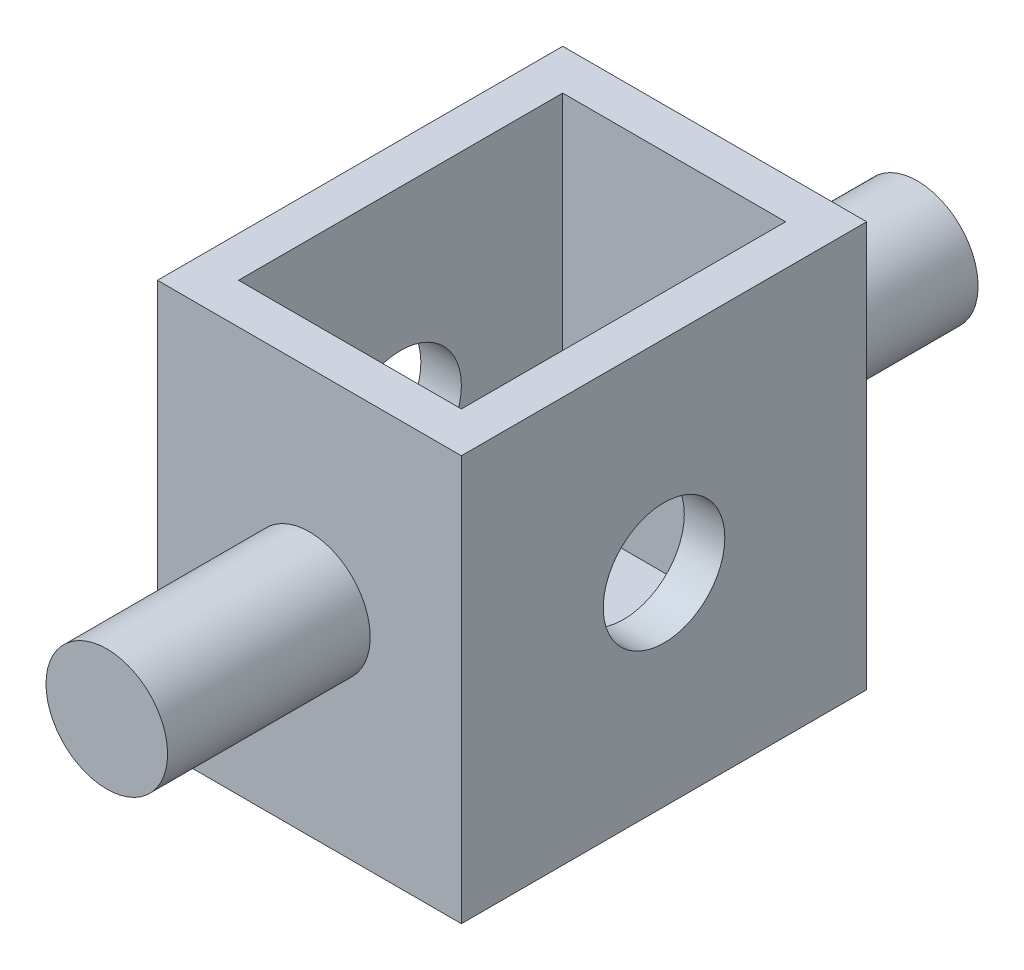
from build123d import *

# Parameters (mm, degrees)
SKETCH1_W          = 19.05
SKETCH1_H          = 25.4
MAIN_BODY_DEPTH    = 25.4
HOLLOW_IT_T        = -2.54
SKETCH3_R          = 3.81
NIBBLE_NO_1_DEPTH  = 12.7
NIBBLE_START       = 12.7
SKETCH4_R          = 3.81
NIBBLE_NO_2_DEPTH  = 12.7
SKETCH5_W          = 1.27
SKETCH5_H          = 3.81
FLAG_DEPTH         = 0.254
SKETCH2_R          = 3.81
NIBBLE_HOLES_DEPTH = 45.45


with BuildPart() as part:
    # Sketch1 → main body (new body)
    with BuildSketch(Plane.XY):
        Rectangle(SKETCH1_W, SKETCH1_H)
    extrude(amount=MAIN_BODY_DEPTH)

    # hollow it
    hollow_it_openings = [part.faces().sort_by_distance(p)[0] for p in [
        (0, 12.7, 12.7),
    ]]
    offset(amount=HOLLOW_IT_T, openings=hollow_it_openings, kind=Kind.INTERSECTION)

    # Sketch3 → nibble no 1 (add)
    with BuildSketch(Plane.XY.offset(25.4)):
        Circle(SKETCH3_R)
    extrude(amount=NIBBLE_NO_1_DEPTH)

    # Sketch4 → nibble no 2 (add)
    with BuildSketch(Plane(origin=(0, 0, 0), x_dir=(-1, 0, 0), z_dir=(0, 0, -1)).offset(NIBBLE_START)):
        Circle(SKETCH4_R)
    extrude(amount=-NIBBLE_NO_2_DEPTH)

    # Sketch5 → flag (add)
    with BuildSketch(Plane(origin=(0, 0, 0), x_dir=(-1, 0, 0), z_dir=(0, -1, 0))):
        with Locations((-0.18666561, 6.353298227)):
            Rectangle(SKETCH5_W, SKETCH5_H)
    extrude(amount=FLAG_DEPTH)

    # Sketch2 → nibble holes (cut, through all)
    with BuildSketch(Plane(origin=(9.525, 0, 0), x_dir=(0, 0, -1), z_dir=(1, 0, 0))):
        with Locations((-12.7, 0)):
            Circle(SKETCH2_R)
    extrude(amount=-NIBBLE_HOLES_DEPTH, mode=Mode.SUBTRACT)


solid = part.part
